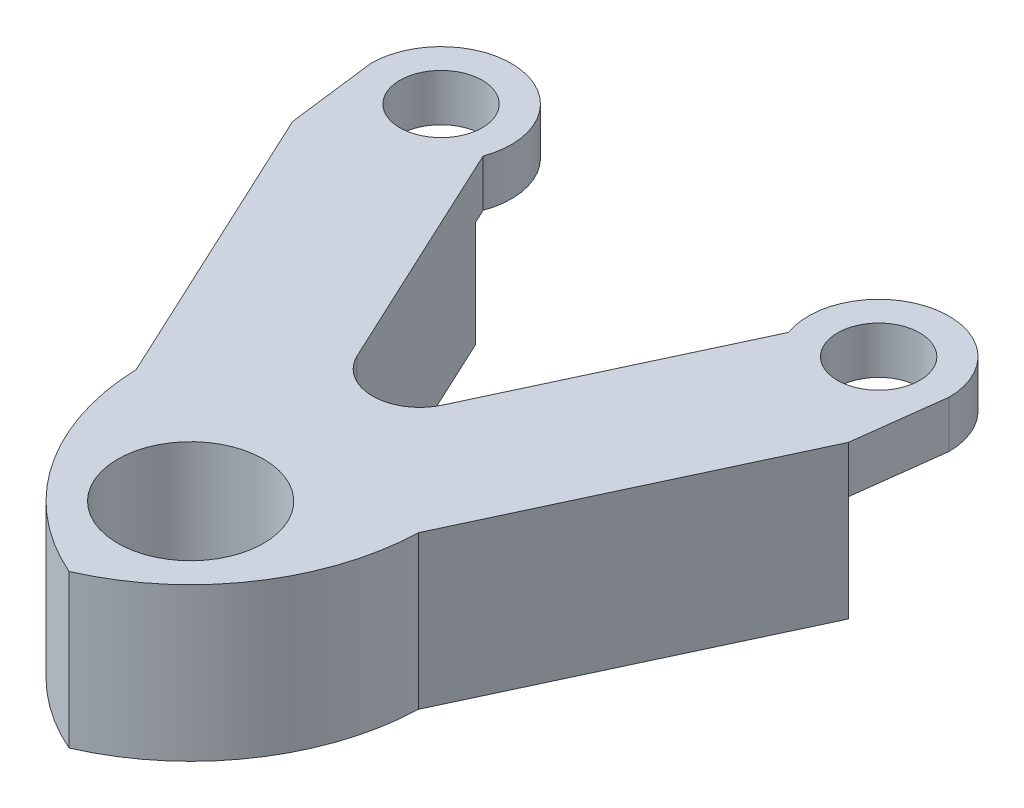
from build123d import *

# Parameters (mm, degrees)
BOSS_EXTRUDE1_DEPTH = 6.5
SKETCH2_R           = 3.1
CUT_EXTRUDE1_DEPTH  = 24.228931445
SKETCH3_R           = 1.75
BOSS_EXTRUDE2_DEPTH = 2
CUT_EXTRUDE2_DEPTH  = 4.5
FILLET1_R           = 10
FILLET2_R           = 2


with BuildPart() as part:
    # Sketch1 → Boss-Extrude1 (new body)
    with BuildSketch(Plane(origin=(0, 0, 0), x_dir=(1, 0, 0), z_dir=(0, 1, 0))):
        with BuildLine():
            Line((-6.489945331, 18.917732676), (0, 5))
            Line((0, 5), (6.489945331, 18.917732676))
            ThreePointArc((6.489945331, 18.917732676), (9.254177969, 17.730205586), (11.809007007, 16.141479285))
            Line((11.809007007, 16.141479285), (6, 3.684023558))
            Line((6, 3.684023558), (6, -6))
            Line((6, -6), (-6, -6))
            Line((-6, -6), (-6, 3.684023558))
            Line((-6, 3.684023558), (-11.809007007, 16.141479285))
            ThreePointArc((-11.809007007, 16.141479285), (-9.254177969, 17.730205586), (-6.489945331, 18.917732676))
        make_face()
    extrude(amount=BOSS_EXTRUDE1_DEPTH)

    # Sketch2 → Cut-Extrude1 (cut, through all)
    with BuildSketch(Plane.XZ):
        with Locations(Location((0, 0, 0), (0, 0, 270))):
            Circle(SKETCH2_R)
    extrude(amount=-CUT_EXTRUDE1_DEPTH, mode=Mode.SUBTRACT)

    # Sketch3 → Boss-Extrude2 (add)
    # profile 1 of 2: a face of its own
    with BuildSketch(Plane(origin=(0, 6.5, 0), x_dir=(1, 0, 0), z_dir=(0, 1, 0))):
        with BuildLine():
            Line((12.285151677, 19.938771315), (11.809007007, 16.141479285))
            Line((11.809007007, 16.141479285), (8.152317162, 17.179463846))
            ThreePointArc((8.152317162, 17.179463846), (7.638707607, 22.42342918), (12.285151677, 19.938771315))
        make_face()
        with Locations(Location((9.297601758, 19.938771315, 0), (0, 0, 270))):
            Circle(SKETCH3_R, mode=Mode.SUBTRACT)
    # profile 2 of 2: a face of its own
    with BuildSketch(Plane(origin=(0, 6.5, 0), x_dir=(1, 0, 0), z_dir=(0, 1, 0))):
        with BuildLine():
            Line((-11.809007007, 16.141479285), (-8.152317162, 17.179463846))
            ThreePointArc((-8.152317162, 17.179463846), (-7.638707607, 22.42342918), (-12.285151677, 19.938771315))
            Line((-12.285151677, 19.938771315), (-11.809007007, 16.141479285))
        make_face()
        with Locations(Location((-9.297601758, 19.938771315, 0), (0, 0, 90))):
            Circle(SKETCH3_R, mode=Mode.SUBTRACT)
    extrude(amount=-BOSS_EXTRUDE2_DEPTH)

    # Sketch5 → Cut-Extrude2 (cut)
    with BuildSketch(Plane.XZ):
        with BuildLine():
            ThreePointArc((10.849326324, -16.801551069), (8.221259471, -16.608382857), (6.203329268, -18.303082545))
            Line((6.203329268, -18.303082545), (6.489945331, -18.917732676))
            ThreePointArc((6.489945331, -18.917732676), (8.733964823, -17.992161028), (10.849326324, -16.801551069))
        make_face()
        with BuildLine():
            Line((6.489945331, -18.917732676), (6.203329268, -18.303082545))
            ThreePointArc((6.203329268, -18.303082545), (8.454973049, -23.335825459), (12.797601758, -19.938771315))
            ThreePointArc((12.797601758, -19.938771315), (12.270902616, -18.092293043), (10.849326324, -16.801551069))
            ThreePointArc((10.849326324, -16.801551069), (8.733964823, -17.992161028), (6.489945331, -18.917732676))
        make_face()
        with BuildLine():
            ThreePointArc((-10.849326324, -16.801551069), (-11.144080031, -22.912072172), (-5.797601758, -19.938771315))
            ThreePointArc((-5.797601758, -19.938771315), (-5.900547614, -19.096142606), (-6.203329268, -18.303082545))
            Line((-6.203329268, -18.303082545), (-6.489945331, -18.917732676))
            ThreePointArc((-6.489945331, -18.917732676), (-8.733964823, -17.992161028), (-10.849326324, -16.801551069))
        make_face()
        with BuildLine():
            Line((-6.489945331, -18.917732676), (-6.203329268, -18.303082545))
            ThreePointArc((-6.203329268, -18.303082545), (-8.221259471, -16.608382857), (-10.849326324, -16.801551069))
            ThreePointArc((-10.849326324, -16.801551069), (-8.733964823, -17.992161028), (-6.489945331, -18.917732676))
        make_face()
    extrude(amount=-CUT_EXTRUDE2_DEPTH, mode=Mode.SUBTRACT)

    # Fillet1
    # the kernel refuses this fillet: 10 mm, written as the material it takes off along each edge
    with BuildSketch(Plane(origin=(6, -24.987516744, 6), x_dir=(-1, 0, 0), z_dir=(0, 1, 0))) as fillet1_piece_1:
        with BuildLine():
            CenterArc((9.995006698, -10), FILLET1_R, 90, 88.189286954)
            Line((0, -9.684023558), (-0.199900134, -9.677704029))
            ThreePointArc((-0.199900134, -9.677704029), (-0.2, -4.842011779), (-0.2, 0))
            Line((-0.2, 0), (0, 0.2))
            Line((0, 0.2), (9.995006698, 0.2))
            Line((9.995006698, 0.2), (9.995006698, 0))
        make_face()
    extrude(amount=56.475033489, mode=Mode.SUBTRACT)
    with BuildSketch(Plane(origin=(-6, -24.987516744, 6), x_dir=(0, 0, -1), z_dir=(0, 1, 0))) as fillet1_piece_2:
        with BuildLine():
            CenterArc((10, -9.995006698), FILLET1_R, 91.810713046, 88.189286954)
            Line((0, -9.995006698), (-0.2, -9.995006698))
            Line((-0.2, -9.995006698), (-0.2, 0))
            Line((-0.2, 0), (0, 0.2))
            ThreePointArc((0, 0.2), (4.842011779, 0.2), (9.677704029, 0.199900134))
            Line((9.677704029, 0.199900134), (9.684023558, 0))
        make_face()
    extrude(amount=56.475033489, mode=Mode.SUBTRACT)

    # Fillet2
    fillet2_edges = [part.edges().sort_by_distance(p)[0] for p in [
        (0, 3.25, -5),
    ]]
    fillet(fillet2_edges, radius=FILLET2_R)


solid = part.part
